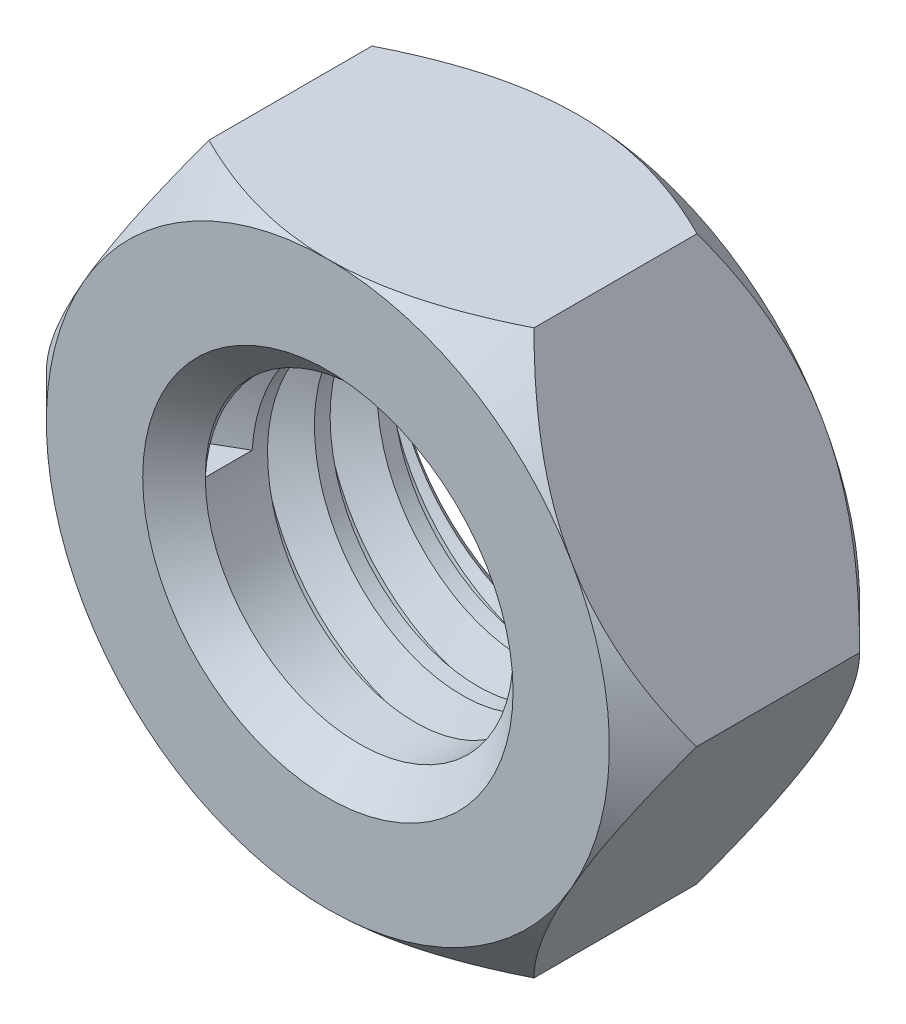
from build123d import *
from build123d.topology import SkipClean

# Parameters (mm, degrees)
BOSS_EXTRUDE1_DEPTH     = 2
SKETCH2_OUTSIDE_W       = 33.162
SKETCH2_OUTSIDE_H       = 31.77
SKETCH2_OUTSIDE_R       = 4.5
CUT_EXTRUDE1_DEPTH      = 8.95298686
CUT_EXTRUDE1_DRAFT      = -45
MIRROR1_COPY_1_SKETCH_W = 33.162
MIRROR1_COPY_1_SKETCH_H = 31.77
MIRROR1_COPY_1_SKETCH_R = 4.5
MIRROR1_COPY_1_DEPTH    = 8.95298686
MIRROR1_COPY_1_DRAFT    = -45
SKETCH3_R               = 2.46
CUT_EXTRUDE2_DEPTH      = 8.95298686
CHAMFER1_SIZE           = 0.5
THREAD1_PITCH           = 1


with BuildPart() as part:
    # Sketch1 → Boss-Extrude1 (new, symmetric)
    with BuildSketch(Plane.XY):
        Polygon((2.598076211, 4.5), (-2.598076211, 4.5), (-5.196152423, 0), (-2.598076211, -4.5), (2.598076211, -4.5), (5.196152423, 0), align=None)
    extrude(amount=BOSS_EXTRUDE1_DEPTH, both=True)


with BuildPart() as cut_extrude1_tool:
    # Sketch2 outside → Cut-Extrude1 (with draft: the straight prism first)
    with BuildSketch(Plane.XY.offset(2)):
        Rectangle(SKETCH2_OUTSIDE_W, SKETCH2_OUTSIDE_H)
        Circle(SKETCH2_OUTSIDE_R, mode=Mode.SUBTRACT)
    extrude(amount=-CUT_EXTRUDE1_DEPTH)
    # Cut-Extrude1: the draft: its side faces are tilted about the plane it starts from
    cut_extrude1_sides = [cut_extrude1_tool.faces().sort_by_distance(p)[0] for p in [
        (0, -15.885, -2.47649343),
        (16.581, 0, -2.47649343),
        (0, 15.885, -2.47649343),
        (-16.581, 0, -2.47649343),
        (-4.5, 0, -2.47649343),
    ]]
    draft(cut_extrude1_sides, Plane.XY.offset(2), CUT_EXTRUDE1_DRAFT)


with BuildPart() as part_1:
    add(part.part)

    # Cut-Extrude1: cut by cut_extrude1_tool
    add(cut_extrude1_tool.part, mode=Mode.SUBTRACT)


with BuildPart() as mirror1_copy_1_tool:
    # Mirror1 copy 1 sketch → Mirror1 copy 1 (with draft: the straight prism first)
    with BuildSketch(Plane(origin=(0, 0, -2), x_dir=(1, 0, 0), z_dir=(0, 0, -1))):
        Rectangle(MIRROR1_COPY_1_SKETCH_W, MIRROR1_COPY_1_SKETCH_H)
        Circle(MIRROR1_COPY_1_SKETCH_R, mode=Mode.SUBTRACT)
    extrude(amount=-MIRROR1_COPY_1_DEPTH)
    # Mirror1 copy 1: the draft: its side faces are tilted about the plane it starts from
    mirror1_copy_1_sides = [mirror1_copy_1_tool.faces().sort_by_distance(p)[0] for p in [
        (0, -15.885, 2.47649343),
        (16.581, 0, 2.47649343),
        (0, 15.885, 2.47649343),
        (-16.581, 0, 2.47649343),
        (-4.5, 0, 2.47649343),
    ]]
    draft(mirror1_copy_1_sides, Plane(origin=(0, 0, -2), x_dir=(1, 0, 0), z_dir=(0, 0, -1)), MIRROR1_COPY_1_DRAFT)


with BuildPart() as part_2:
    add(part_1.part)

    # Mirror1 copy 1: cut by mirror1_copy_1_tool
    add(mirror1_copy_1_tool.part, mode=Mode.SUBTRACT)

    # Sketch3 → Cut-Extrude2 (cut, through all)
    with BuildSketch(Plane.XY.offset(2)):
        Circle(SKETCH3_R)
    extrude(amount=-CUT_EXTRUDE2_DEPTH, mode=Mode.SUBTRACT)

    # Chamfer1
    chamfer1_edges = [part_2.edges().sort_by_distance(p)[0] for p in [
        (-2.46, 0, -2),
        (-2.46, 0, 2),
    ]]
    chamfer(chamfer1_edges, length=CHAMFER1_SIZE)

    # Thread1: the profile of Thread Profile1 profile screwed along a right-hand helix of 3.5 turns, 8 arcs to a turn; built about Z, then put on its axis
    with SkipClean():  # the faces are left unmerged after this step: merging them gives an invalid solid
        thread1_z = Axis((0, 0, 0), (0, 0, 1))
        thread1_corners = [(2.4597, 0, -0.000173205), (3.001265875, 0, 0.312499999), (3.001265875, 0, 0.437499999), (2.4597, 0, 0.750173202)]
        with BuildLine(mode=Mode.PRIVATE) as thread1_profile:
            Line(thread1_corners[0], thread1_corners[1])
            Line(thread1_corners[1], thread1_corners[2])
            Line(thread1_corners[2], thread1_corners[3])
            Line(thread1_corners[3], thread1_corners[0])
        thread1_cap = Face(thread1_profile.wire())
        thread1_turn_angles = [0, 22.5, 45, 67.5, 90, 112.5, 135, 157.5, 180, 202.5, 225, 247.5, 270, 292.5, 315, 337.5, 360]
        thread1_turn_weights = [1, 0.9238795325112867, 1, 0.9238795325112867, 1, 0.9238795325112867, 1, 0.9238795325112867, 1, 0.9238795325112867, 1, 0.9238795325112867, 1, 0.9238795325112867, 1, 0.9238795325112867, 1]
        thread1_turn_rails = [Edge.make_bspline([Vector(p[0], p[1], 0).rotate(thread1_z, thread1_turn_angles[k]) / thread1_turn_weights[k] + Vector(0, 0, p[2] + THREAD1_PITCH * thread1_turn_angles[k] / 360) for k in range(17)], [0, 0, 0, 1, 1, 2, 2, 3, 3, 4, 4, 5, 5, 6, 6, 7, 7, 8, 8, 8], 2, thread1_turn_weights) for p in thread1_corners]
        thread1_turn_sides = [Face.make_surface_from_curves(thread1_turn_rails[p[0]], thread1_turn_rails[p[1]]) for p in [(0, 1), (1, 2), (2, 3), (3, 0)]]
        thread1_last_angles = [1080, 1102.5, 1125, 1147.5, 1170, 1192.5, 1215, 1237.5, 1260]
        thread1_last_weights = [1, 0.9238795325112867, 1, 0.9238795325112867, 1, 0.9238795325112867, 1, 0.923879532511286, 1]
        thread1_last_rails = [Edge.make_bspline([Vector(p[0], p[1], 0).rotate(thread1_z, thread1_last_angles[k]) / thread1_last_weights[k] + Vector(0, 0, p[2] + THREAD1_PITCH * thread1_last_angles[k] / 360) for k in range(9)], [0, 0, 0, 1, 1, 2, 2, 3, 3, 4, 4, 4], 2, thread1_last_weights) for p in thread1_corners]
        thread1_last_sides = [Face.make_surface_from_curves(thread1_last_rails[p[0]], thread1_last_rails[p[1]]) for p in [(0, 1), (1, 2), (2, 3), (3, 0)]]
        thread1 = Plane(origin=(0, 0, 1.5), x_dir=(-1, 0, 0), z_dir=(0, 0, -1)) * Solid(Shell([*[p.moved(Location((0, 0, THREAD1_PITCH * i))) for i in range(3) for p in thread1_turn_sides], *thread1_last_sides, thread1_cap, thread1_cap.rotate(thread1_z, 1260).moved(Location((0, 0, THREAD1_PITCH * 1260 / 360)))]))
        add(thread1, mode=Mode.SUBTRACT)


solid = part_2.part
